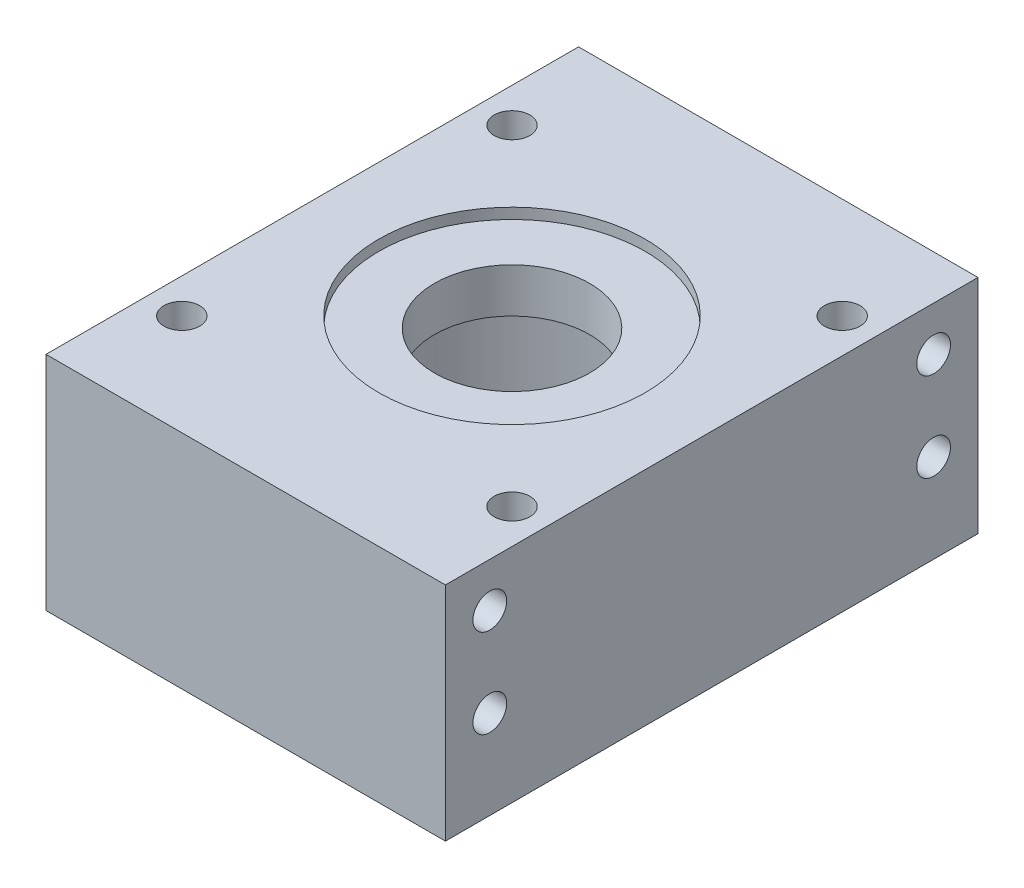
from build123d import *

# Parameters (mm, degrees)
SKETCH1_R              = 2.5527
BOSS_EXTRUDE1_DEPTH    = 31.75
SKETCH2_R              = 19.05
CUT_EXTRUDE1_DEPTH     = 1.524
SKETCH3_R              = 11.1125
CUT_EXTRUDE2_DEPTH     = 57.407018189
CUT_EXTRUDE3_DEPTH     = 23.876
SKETCH5_R              = 26.19375
CUT_EXTRUDE4_DEPTH     = 17.526
CUT_EXTRUDE5_DEPTH     = 3.175
F_10_32_TAPPED_HOLE1_D = 4.826


with BuildPart() as part:
    # Sketch1 → Boss-Extrude1 (new body)
    with BuildSketch(Plane(origin=(0, 0, 0), x_dir=(1, 0, 0), z_dir=(0, 1, 0))):
        Polygon((-28.575, 28.575), (-28.575, 38.1), (28.575, 38.1), (28.575, 28.575), (28.575, -28.575), (28.575, -38.1), (-28.575, -38.1), (-28.575, -28.575), align=None)
        with Locations((23.622, -23.622)):
            Circle(SKETCH1_R, mode=Mode.SUBTRACT)
        with Locations((23.622, 23.622)):
            Circle(SKETCH1_R, mode=Mode.SUBTRACT)
        with Locations((-23.622, 23.622)):
            Circle(SKETCH1_R, mode=Mode.SUBTRACT)
        with Locations((-23.622, -23.622)):
            Circle(SKETCH1_R, mode=Mode.SUBTRACT)
    extrude(amount=BOSS_EXTRUDE1_DEPTH)

    # Sketch2 → Cut-Extrude1 (cut)
    with BuildSketch(Plane(origin=(0, 31.75, 0), x_dir=(1, 0, 0), z_dir=(0, 1, 0))):
        Circle(SKETCH2_R)
    extrude(amount=-CUT_EXTRUDE1_DEPTH, mode=Mode.SUBTRACT)

    # Sketch3 → Cut-Extrude2 (cut, through all)
    with BuildSketch(Plane(origin=(0, 30.226, 0), x_dir=(1, 0, 0), z_dir=(0, 1, 0))):
        Circle(SKETCH3_R)
    extrude(amount=-CUT_EXTRUDE2_DEPTH, mode=Mode.SUBTRACT)

    # Sketch4 → Cut-Extrude3 (cut)
    with BuildSketch(Plane.XZ):
        with BuildLine():
            ThreePointArc((0, 20.955), (1.652808564, 21.41912397), (2.822399445, 22.675803874))
            ThreePointArc((2.822399445, 22.675803874), (7.210100154, 24.555346085), (9.885111639, 20.602004462))
            ThreePointArc((9.885111639, 20.602004462), (10.189621648, 18.912489483), (11.32912833, 17.62846778))
            ThreePointArc((11.32912833, 17.62846778), (12.970483736, 17.125337937), (14.633818648, 17.550195776))
            ThreePointArc((14.633818648, 17.550195776), (19.341144607, 16.759197203), (19.454169622, 11.9872142))
            ThreePointArc((19.454169622, 11.9872142), (18.796918984, 10.401273215), (19.061338463, 8.705021597))
            ThreePointArc((19.061338463, 8.705021597), (20.170121967, 7.39437811), (21.799103827, 6.852524522))
            ThreePointArc((21.799103827, 6.852524522), (25.331512305, 3.642121623), (22.846666207, -0.433431873))
            ThreePointArc((22.846666207, -0.433431873), (21.436327355, -1.412273807), (20.741708315, -2.982207436))
            ThreePointArc((20.741708315, -2.982207436), (20.965888988, -4.68424452), (22.043327566, -6.02077485))
            ThreePointArc((22.043327566, -6.02077485), (23.27930383, -10.631301837), (18.985507698, -12.716466389))
            ThreePointArc((18.985507698, -12.716466389), (17.269853253, -12.777433874), (15.836732331, -13.72260668))
            ThreePointArc((15.836732331, -13.72260668), (15.105134394, -15.275652613), (15.288950554, -16.982520747))
            ThreePointArc((15.288950554, -16.982520747), (13.836080873, -21.529362082), (9.09658464, -20.962112676))
            ThreePointArc((9.09658464, -20.962112676), (7.620322766, -20.085848967), (5.903705729, -20.106175262))
            ThreePointArc((5.903705729, -20.106175262), (4.448606357, -21.017148933), (3.680439768, -22.552436301))
            ThreePointArc((3.680439768, -22.552436301), (0, -25.592001984), (-3.680439768, -22.552436301))
            ThreePointArc((-3.680439768, -22.552436301), (-4.448606357, -21.017148933), (-5.903705729, -20.106175262))
            ThreePointArc((-5.903705729, -20.106175262), (-7.620322766, -20.085848967), (-9.09658464, -20.962112676))
            ThreePointArc((-9.09658464, -20.962112676), (-13.836080873, -21.529362082), (-15.288950554, -16.982520747))
            ThreePointArc((-15.288950554, -16.982520747), (-15.105134394, -15.275652613), (-15.836732331, -13.72260668))
            ThreePointArc((-15.836732331, -13.72260668), (-17.269853253, -12.777433874), (-18.985507698, -12.716466389))
            ThreePointArc((-18.985507698, -12.716466389), (-23.27930383, -10.631301837), (-22.043327566, -6.02077485))
            ThreePointArc((-22.043327566, -6.02077485), (-20.965888988, -4.68424452), (-20.741708315, -2.982207436))
            ThreePointArc((-20.741708315, -2.982207436), (-21.436327355, -1.412273807), (-22.846666207, -0.433431873))
            ThreePointArc((-22.846666207, -0.433431873), (-25.331512305, 3.642121623), (-21.799103827, 6.852524522))
            ThreePointArc((-21.799103827, 6.852524522), (-20.170121967, 7.39437811), (-19.061338463, 8.705021597))
            ThreePointArc((-19.061338463, 8.705021597), (-18.796918984, 10.401273215), (-19.454169622, 11.9872142))
            ThreePointArc((-19.454169622, 11.9872142), (-19.341144607, 16.759197203), (-14.633818648, 17.550195776))
            ThreePointArc((-14.633818648, 17.550195776), (-12.970483736, 17.125337937), (-11.32912833, 17.62846778))
            ThreePointArc((-11.32912833, 17.62846778), (-10.189621648, 18.912489483), (-9.885111639, 20.602004462))
            ThreePointArc((-9.885111639, 20.602004462), (-7.210100154, 24.555346085), (-2.822399445, 22.675803874))
            ThreePointArc((-2.822399445, 22.675803874), (-1.652808564, 21.41912397), (0, 20.955))
        make_face()
    extrude(amount=-CUT_EXTRUDE3_DEPTH, mode=Mode.SUBTRACT)

    # Sketch5 → Cut-Extrude4 (cut)
    with BuildSketch(Plane.XZ):
        Circle(SKETCH5_R)
    extrude(amount=-CUT_EXTRUDE4_DEPTH, mode=Mode.SUBTRACT)

    # Sketch7 → Cut-Extrude5 (cut)
    with BuildSketch(Plane.XZ):
        with BuildLine():
            Line((-23.8125, 26.9875), (23.8125, 26.9875))
            ThreePointArc((23.8125, 26.9875), (26.05756403, 26.05756403), (26.9875, 23.8125))
            Line((26.9875, 23.8125), (26.9875, -23.8125))
            ThreePointArc((26.9875, -23.8125), (26.05756403, -26.05756403), (23.8125, -26.9875))
            Line((23.8125, -26.9875), (-23.8125, -26.9875))
            ThreePointArc((-23.8125, -26.9875), (-26.05756403, -26.05756403), (-26.9875, -23.8125))
            Line((-26.9875, -23.8125), (-26.9875, 23.8125))
            ThreePointArc((-26.9875, 23.8125), (-26.05756403, 26.05756403), (-23.8125, 26.9875))
        make_face()
    extrude(amount=-CUT_EXTRUDE5_DEPTH, mode=Mode.SUBTRACT)

    # #10-32 Tapped Hole1 (through all)
    with Locations(Plane(origin=(28.575, 0, 0), x_dir=(0, 0, -1), z_dir=(1, 0, 0))):
        with Locations((-31.75, 25.4), (-31.75, 12.7), (31.75, 12.7), (31.75, 25.4)):
            Hole(F_10_32_TAPPED_HOLE1_D / 2)


solid = part.part
